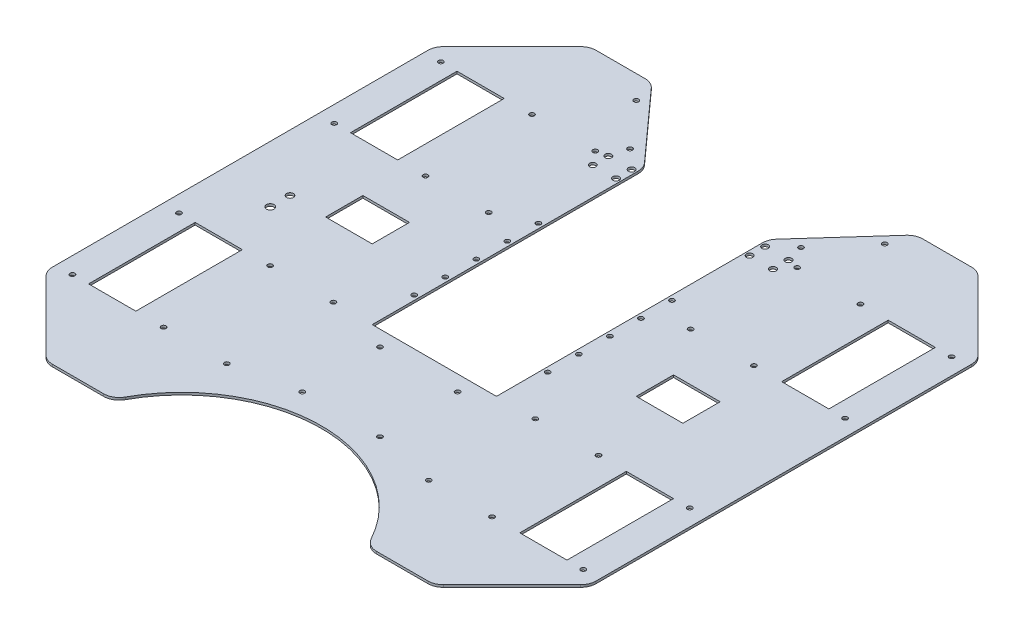
from build123d import *

# Parameters (mm, degrees)
SKETCH_1_R          = 1.55
SKETCH_1_W          = 30.4
SKETCH_1_H          = 68.58
SKETCH_1_R_2        = 2.5
SKETCH_1_R_3        = 2.205
SKETCH_1_R_4        = 2.05
EXTRUDE_1_DEPTH     = 1.5
FILLET_1_R          = 10
FILLET_2_R          = 10
FILLET_3_R          = 10
SKETCH_2_W          = 80
SKETCH_2_H          = 135
CUT_EXTRUDE_1_DEPTH = 10
SKETCH_3_W          = 30
SKETCH_3_H          = 24
CUT_EXTRUDE_2_DEPTH = 10
SKETCH_1_4_R        = 1.55
CUT_EXTRUDE_3_DEPTH = 10


with BuildPart() as part:
    # 草图1 → 凸台-拉伸1 (new body)
    with BuildSketch(Plane(origin=(0, 0, 0), x_dir=(1, 0, 0), z_dir=(0, 1, 0))):
        with BuildLine():
            Line((-85, 175), (-125, 175))
            Line((-125, 175), (-175, 125))
            Line((-175, 125), (-175, -125))
            Line((-175, -125), (-125, -175))
            Line((-125, -175), (-81.710313025, -175))
            ThreePointArc((-81.710313025, -175), (0, -122.728301649), (81.710313025, -175))
            Line((81.710313025, -175), (125, -175))
            Line((125, -175), (175, -125))
            Line((175, -125), (175, 125))
            Line((175, 125), (125, 175))
            Line((125, 175), (85, 175))
            Line((85, 175), (40, 125))
            Line((40, 125), (40, 85))
            Line((40, 85), (-40, 85))
            Line((-40, 85), (-40, 125))
            Line((-40, 125), (-85, 175))
        make_face()
        with Locations((-164.434, -118.58)):
            Circle(SKETCH_1_R, mode=Mode.SUBTRACT)
        with Locations((-105.72, -118.58)):
            Circle(SKETCH_1_R, mode=Mode.SUBTRACT)
        with Locations((-65, -118.58)):
            Circle(SKETCH_1_R, mode=Mode.SUBTRACT)
        with Locations((-25, -110)):
            Circle(SKETCH_1_R, mode=Mode.SUBTRACT)
        with Locations((-138.794, -84.29)):
            Rectangle(SKETCH_1_W, SKETCH_1_H, mode=Mode.SUBTRACT)
        with Locations((-164.434, -50)):
            Circle(SKETCH_1_R, mode=Mode.SUBTRACT)
        with Locations((-105.72, -50)):
            Circle(SKETCH_1_R, mode=Mode.SUBTRACT)
        with Locations((-138.472923085, -17.157455951)):
            Circle(SKETCH_1_R_2, mode=Mode.SUBTRACT)
        with Locations((-138.472923085, -4.457455951)):
            Circle(SKETCH_1_R_3, mode=Mode.SUBTRACT)
        with Locations((-65, -50)):
            Circle(SKETCH_1_R, mode=Mode.SUBTRACT)
        with Locations((-25, -60)):
            Circle(SKETCH_1_R, mode=Mode.SUBTRACT)
        with Locations((25, -110)):
            Circle(SKETCH_1_R, mode=Mode.SUBTRACT)
        with Locations((65, -118.58)):
            Circle(SKETCH_1_R, mode=Mode.SUBTRACT)
        with Locations((105.72, -118.58)):
            Circle(SKETCH_1_R, mode=Mode.SUBTRACT)
        with Locations((164.434, -118.58)):
            Circle(SKETCH_1_R, mode=Mode.SUBTRACT)
        with Locations((25, -60)):
            Circle(SKETCH_1_R, mode=Mode.SUBTRACT)
        with Locations((65, -50)):
            Circle(SKETCH_1_R, mode=Mode.SUBTRACT)
        with Locations((105.72, -50)):
            Circle(SKETCH_1_R, mode=Mode.SUBTRACT)
        with Locations((138.794, -84.29)):
            Rectangle(SKETCH_1_W, SKETCH_1_H, mode=Mode.SUBTRACT)
        with Locations((164.434, -50)):
            Circle(SKETCH_1_R, mode=Mode.SUBTRACT)
        with Locations((-164.434, 50)):
            Circle(SKETCH_1_R, mode=Mode.SUBTRACT)
        with Locations((-138.794, 84.29)):
            Rectangle(SKETCH_1_W, SKETCH_1_H, mode=Mode.SUBTRACT)
        with Locations((-105.72, 50)):
            Circle(SKETCH_1_R, mode=Mode.SUBTRACT)
        with Locations((-65, 50)):
            Circle(SKETCH_1_R, mode=Mode.SUBTRACT)
        with Locations((-164.434, 118.58)):
            Circle(SKETCH_1_R, mode=Mode.SUBTRACT)
        with Locations((-105.72, 118.58)):
            Circle(SKETCH_1_R, mode=Mode.SUBTRACT)
        with Locations((-58, 110)):
            Circle(SKETCH_1_R_4, mode=Mode.SUBTRACT)
        with Locations((-65, 118.58)):
            Circle(SKETCH_1_R, mode=Mode.SUBTRACT)
        with Locations((-58, 120)):
            Circle(SKETCH_1_R_4, mode=Mode.SUBTRACT)
        with Locations((-55, 131)):
            Circle(SKETCH_1_R, mode=Mode.SUBTRACT)
        with Locations((-43, 110)):
            Circle(SKETCH_1_R_4, mode=Mode.SUBTRACT)
        with Locations((-43, 120)):
            Circle(SKETCH_1_R_4, mode=Mode.SUBTRACT)
        with Locations((-80, 160)):
            Circle(SKETCH_1_R, mode=Mode.SUBTRACT)
        with Locations((65, 50)):
            Circle(SKETCH_1_R, mode=Mode.SUBTRACT)
        with Locations((105.72, 50)):
            Circle(SKETCH_1_R, mode=Mode.SUBTRACT)
        with Locations((164.434, 50)):
            Circle(SKETCH_1_R, mode=Mode.SUBTRACT)
        with Locations((138.794, 84.29)):
            Rectangle(SKETCH_1_W, SKETCH_1_H, mode=Mode.SUBTRACT)
        with Locations((43, 110)):
            Circle(SKETCH_1_R_4, mode=Mode.SUBTRACT)
        with Locations((43, 120)):
            Circle(SKETCH_1_R_4, mode=Mode.SUBTRACT)
        with Locations((58, 110)):
            Circle(SKETCH_1_R_4, mode=Mode.SUBTRACT)
        with Locations((58, 120)):
            Circle(SKETCH_1_R_4, mode=Mode.SUBTRACT)
        with Locations((65, 118.58)):
            Circle(SKETCH_1_R, mode=Mode.SUBTRACT)
        with Locations((55, 131)):
            Circle(SKETCH_1_R, mode=Mode.SUBTRACT)
        with Locations((80, 160)):
            Circle(SKETCH_1_R, mode=Mode.SUBTRACT)
        with Locations((105.72, 118.58)):
            Circle(SKETCH_1_R, mode=Mode.SUBTRACT)
        with Locations((164.434, 118.58)):
            Circle(SKETCH_1_R, mode=Mode.SUBTRACT)
    extrude(amount=EXTRUDE_1_DEPTH)

    # 圆角1
    fillet_1_edges = [part.edges().sort_by_distance(p)[0] for p in [
        (-40, 0.75, -125),
    ]]
    fillet(fillet_1_edges, radius=FILLET_1_R)

    # 圆角2
    fillet_2_edges = [part.edges().sort_by_distance(p)[0] for p in [
        (40, 0.75, -125),
    ]]
    fillet(fillet_2_edges, radius=FILLET_2_R)

    # 圆角3
    fillet_3_edges = [part.edges().sort_by_distance(p)[0] for p in [
        (-85, 0.75, -175),
        (85, 0.75, -175),
        (125, 0.75, -175),
        (175, 0.75, -125),
        (175, 0.75, 125),
        (125, 0.75, 175),
        (81.710313025, 0.75, 175),
        (-81.710313025, 0.75, 175),
        (-125, 0.75, 175),
        (-175, 0.75, 125),
        (-175, 0.75, -125),
        (-125, 0.75, -175),
    ]]
    fillet(fillet_3_edges, radius=FILLET_3_R)

    # 草图2 → 切除-拉伸1 (cut)
    with BuildSketch(Plane(origin=(0, 1.5, 0), x_dir=(1, 0, 0), z_dir=(0, 1, 0))):
        with Locations((0, 17.5)):
            Rectangle(SKETCH_2_W, SKETCH_2_H)
    extrude(amount=-CUT_EXTRUDE_1_DEPTH, mode=Mode.SUBTRACT)

    # 草图3 → 切除-拉伸2 (cut)
    with BuildSketch(Plane(origin=(0, 1.5, 0), x_dir=(1, 0, 0), z_dir=(0, 1, 0))):
        with Locations((-100, 7)):
            Rectangle(SKETCH_3_W, SKETCH_3_H)
        with Locations((100, 7)):
            Rectangle(SKETCH_3_W, SKETCH_3_H)
    extrude(amount=-CUT_EXTRUDE_2_DEPTH, mode=Mode.SUBTRACT)

    # 草图1<4> → 切除-拉伸3 (cut)
    with BuildSketch(Plane(origin=(0, 0, 0), x_dir=(1, 0, 0), z_dir=(0, 1, 0))):
        with Locations((43, -20)):
            Circle(SKETCH_1_4_R)
        with Locations((43, 0)):
            Circle(SKETCH_1_4_R)
        with Locations((43, 20)):
            Circle(SKETCH_1_4_R)
        with Locations((43, 40)):
            Circle(SKETCH_1_4_R)
        with Locations((43, 60)):
            Circle(SKETCH_1_4_R)
        with Locations((-43, -20)):
            Circle(SKETCH_1_4_R)
        with Locations((-43, 0)):
            Circle(SKETCH_1_4_R)
        with Locations((-43, 20)):
            Circle(SKETCH_1_4_R)
        with Locations((-43, 40)):
            Circle(SKETCH_1_4_R)
        with Locations((-43, 60)):
            Circle(SKETCH_1_4_R)
    extrude(amount=CUT_EXTRUDE_3_DEPTH, mode=Mode.SUBTRACT)


solid = part.part
